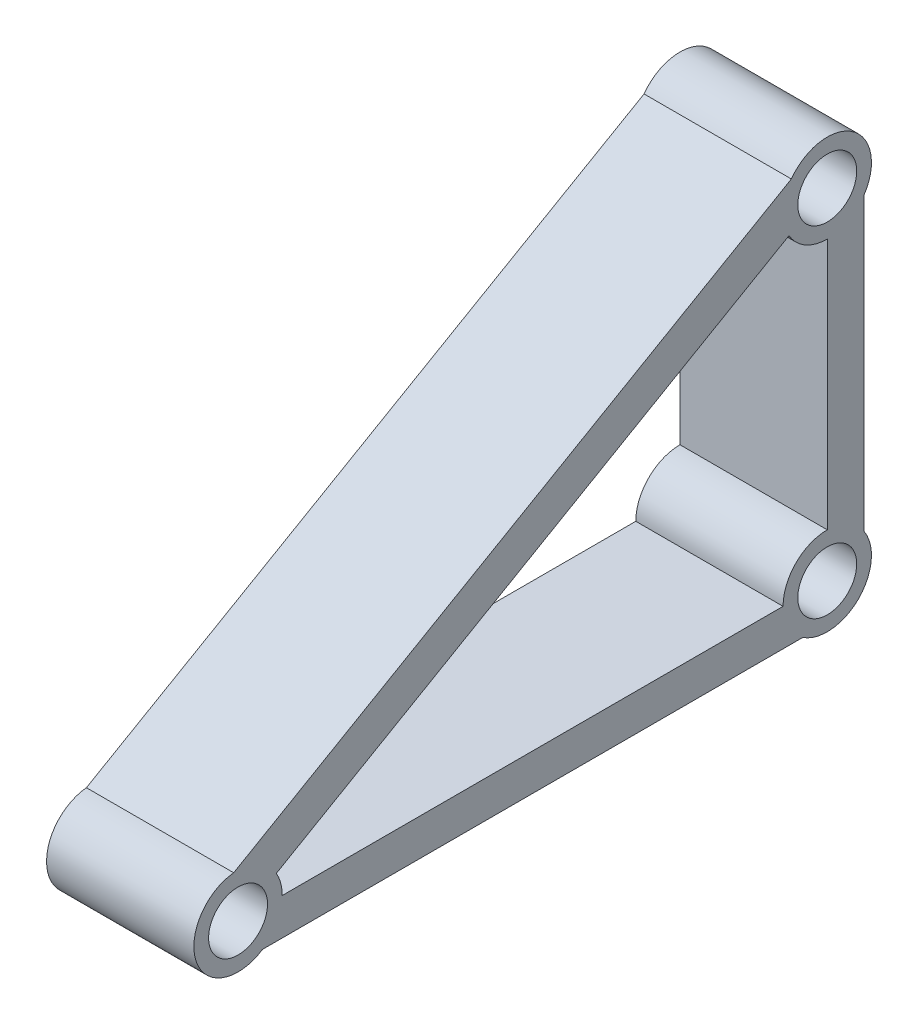
from build123d import *

# Parameters (mm, degrees)
SKETCH2_R           = 40
BOSS_EXTRUDE1_DEPTH = 200


with BuildPart() as part:
    # Sketch2 → Boss-Extrude1 (new body)
    with BuildSketch(Plane(origin=(0, 0, 0), x_dir=(0, 0, -1), z_dir=(1, 0, 0))):
        with BuildLine():
            Line((1578.695495681, 150.438486896), (1578.695495681, 545.98620644))
            ThreePointArc((1578.695495681, 545.98620644), (1562.784497503, 628.527953883), (1479.961523957, 614.152454344))
            Line((1479.961523957, 614.152454344), (722.751592411, 176.977096532))
            ThreePointArc((722.751592411, 176.977096532), (672.17954259, 97.124111382), (761.861743585, 67.272238992))
            Line((761.861743585, 67.272238992), (1495.529247778, 67.272238992))
            ThreePointArc((1495.529247778, 67.272238992), (1571.121902553, 74.845832121), (1578.695495681, 150.438486896))
        make_face()
        with BuildLine():
            Line((1528.695495681, 519.152454344), (1528.695495681, 177.272238992))
            ThreePointArc((1528.695495681, 177.272238992), (1486.26908881, 159.698645863), (1468.695495681, 117.272238992))
            Line((1468.695495681, 117.272238992), (788.695495681, 117.272238992))
            ThreePointArc((788.695495681, 117.272238992), (786.651045259, 132.801381698), (780.657019908, 147.272238992))
            Line((780.657019908, 147.272238992), (1476.733971454, 549.152454344))
            ThreePointArc((1476.733971454, 549.152454344), (1498.695495681, 527.190930117), (1528.695495681, 519.152454344))
        make_face(mode=Mode.SUBTRACT)
        with Locations((1528.695495681, 579.152454344)):
            Circle(SKETCH2_R, mode=Mode.SUBTRACT)
        with Locations((1528.695495681, 117.272238992)):
            Circle(SKETCH2_R, mode=Mode.SUBTRACT)
        with Locations((728.695495681, 117.272238992)):
            Circle(SKETCH2_R, mode=Mode.SUBTRACT)
    extrude(amount=BOSS_EXTRUDE1_DEPTH)


solid = part.part
